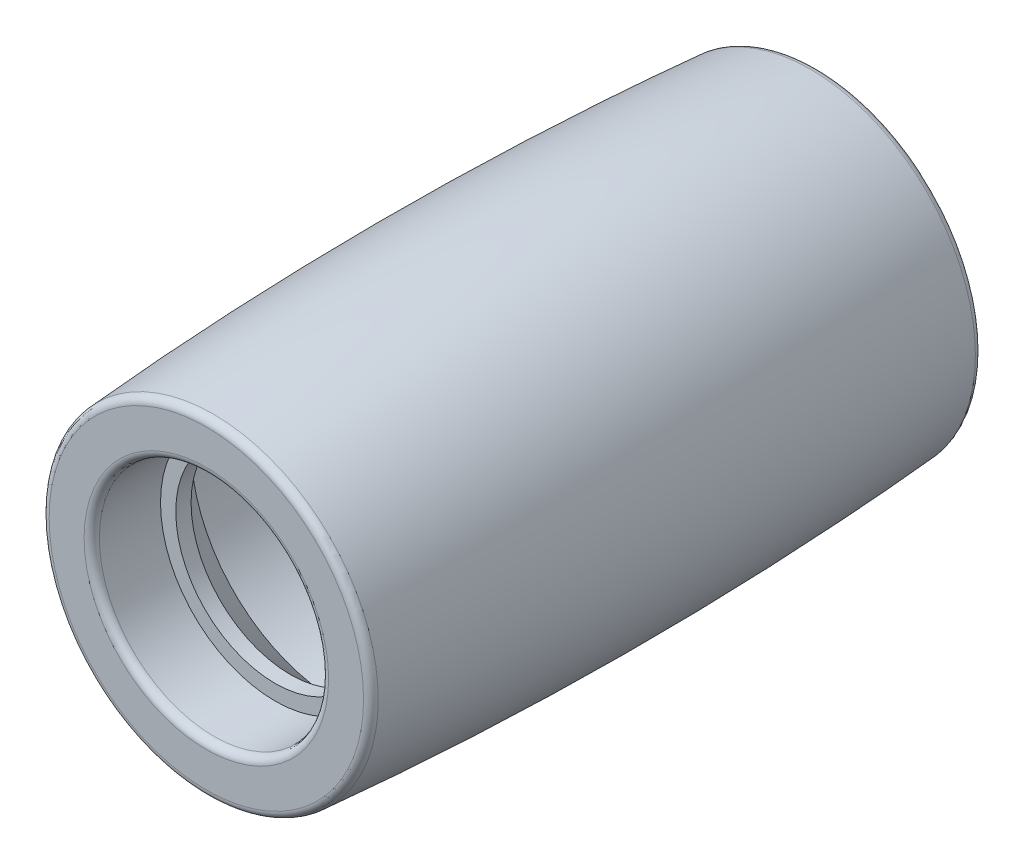
from build123d import *

# Parameters (mm, degrees)
KREISMUSTER2_COUNT = 4
VERRUNDUNG1_R      = 1


with BuildPart() as part:
    # Skizze1 → Rotation1 (revolve)
    with BuildSketch(Plane(origin=(0, 0, 0), x_dir=(0, 0, -1), z_dir=(1, 0, 0))):
        with BuildLine():
            Line((90, 21.5), (90, 20.25))
            Line((90, 20.25), (87.144506921, 20.25))
            Line((87.144506921, 20.25), (85, 19.25))
            Line((85, 19.25), (46.3, 19.25))
            Line((46.3, 19.25), (46.3, 11))
            Line((46.3, 11), (43.3, 11))
            Line((43.3, 11), (43.3, 19.25))
            Line((43.3, 19.25), (27.25, 19.25))
            Line((27.25, 19.25), (21, 13))
            Line((21, 13), (19, 13))
            Line((19, 13), (19, 15))
            Line((19, 15), (10, 15))
            Line((10, 15), (10, 21.5))
            ThreePointArc((10, 21.5), (50, 23), (90, 21.5))
        make_face()
    revolve(axis=Axis((0, 0, 0), (0, 0, -1)))

    # Skizze5 → Ø3.6 (3.6) Durchmesser Bohrung2 (revolve, cut)
    with BuildSketch(Plane(origin=(0, 14, -43.3), x_dir=(0, -1, 0), z_dir=(1, 0, 0))):
        Polygon((0, 0), (0, 10.581549114), (1.8, 9.5), (1.8, 0), align=None)
    f_3_6_3_6_durchmesser_bohrung2 = revolve(axis=Axis((0, 14, -36.95), (0, 0, -1)), mode=Mode.SUBTRACT)

    # Kreismuster2: Ø3.6 (3.6) Durchmesser Bohrung2 ×4 about axis
    kreismuster2_axis = Axis((0, 0, 0), (0, 0, 1))
    for i in range(1, KREISMUSTER2_COUNT):
        add(f_3_6_3_6_durchmesser_bohrung2.rotate(kreismuster2_axis, i * 360 / KREISMUSTER2_COUNT), mode=Mode.SUBTRACT)

    # Verrundung1
    verrundung1_edges = [part.edges().sort_by_distance(p)[0] for p in [
        (0, -21.5, -90),
        (0, -21.5, -10),
        (0, -15, -10),
    ]]
    fillet(verrundung1_edges, radius=VERRUNDUNG1_R)


solid = part.part
